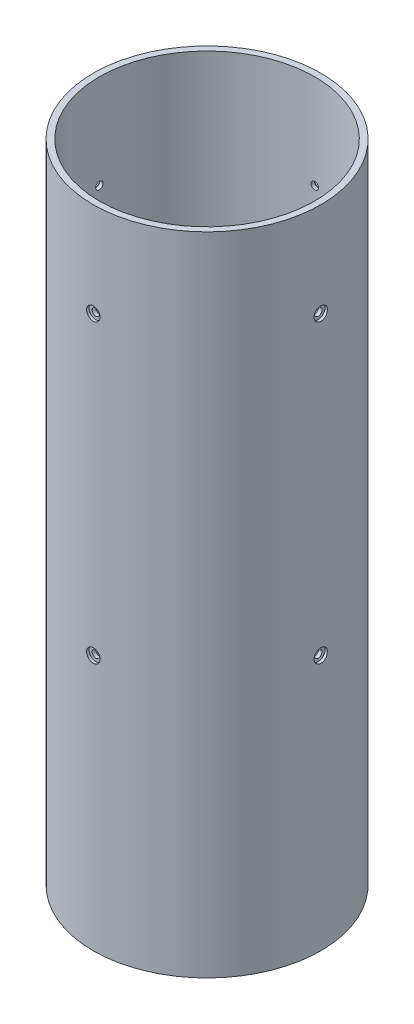
from build123d import *

# Parameters (mm, degrees)
SKETCH1_R             = 53.721
SKETCH1_R_2           = 50.8
BOSS_EXTRUDE1_DEPTH   = 304.8
SKETCH2_R             = 1.7526
BULKHEAD_HOLES_DEPTH  = 127
CIRPATTERN1_COUNT     = 4
CUT_EXTRUDE1_REACH    = 329.617
SKETCH3_R             = 1.7526
CIRPATTERN2_COUNT     = 4
SKETCH4_R             = 3.175
COUNTERSINK_CUT_DEPTH = 1.27
CIRPATTERN3_COUNT     = 4


with BuildPart() as part:
    # Sketch1 → Boss-Extrude1 (new body)
    with BuildSketch(Plane(origin=(0, 0, 0), x_dir=(1, 0, 0), z_dir=(0, 1, 0))):
        Circle(SKETCH1_R)
        Circle(SKETCH1_R_2, mode=Mode.SUBTRACT)
    extrude(amount=BOSS_EXTRUDE1_DEPTH)

    # Sketch2 → Bulkhead Holes (cut)
    with BuildSketch(Plane.XY):
        with Locations((0, 120.65)):
            Circle(SKETCH2_R)
    bulkhead_holes = extrude(amount=-BULKHEAD_HOLES_DEPTH, mode=Mode.SUBTRACT)

    # CirPattern1: Bulkhead Holes ×4 about axis
    cirpattern1_axis = Axis((0, 304.8, 0), (0, -1, 0))
    for i in range(1, CIRPATTERN1_COUNT):
        add(bulkhead_holes.rotate(cirpattern1_axis, i * 360 / CIRPATTERN1_COUNT), mode=Mode.SUBTRACT)

    # Sketch3 → Cut-Extrude1 (cut, up to next)
    with BuildSketch(Plane(origin=(53.721, 0, 0), x_dir=(0, 0, -1), z_dir=(1, 0, 0)), mode=Mode.PRIVATE) as cut_extrude1_sk1:
        with Locations((0, 260.35)):
            Circle(SKETCH3_R)
    cut_extrude1_tool1 = extrude(cut_extrude1_sk1.sketch, amount=-CUT_EXTRUDE1_REACH, mode=Mode.PRIVATE) & part.part
    cut_extrude1 = cut_extrude1_tool1.solids().sort_by_distance((53.721, 260.35, 0))[0]
    add(cut_extrude1, mode=Mode.SUBTRACT)

    # CirPattern2: Cut-Extrude1 ×4 about axis
    cirpattern2_axis = Axis((0, 304.8, 0), (0, -1, 0))
    for i in range(1, CIRPATTERN2_COUNT):
        add(cut_extrude1.rotate(cirpattern2_axis, i * 360 / CIRPATTERN2_COUNT), mode=Mode.SUBTRACT)

    # Sketch4 → Countersink Cut (cut)
    with BuildSketch(Plane(origin=(53.721, 0, 0), x_dir=(0, 0, -1), z_dir=(1, 0, 0))):
        with Locations((0, 260.35)):
            Circle(SKETCH4_R)
        with Locations((0, 120.65)):
            Circle(SKETCH4_R)
    countersink_cut = extrude(amount=-COUNTERSINK_CUT_DEPTH, mode=Mode.SUBTRACT)

    # CirPattern3: Countersink Cut ×4 about axis
    cirpattern3_axis = Axis((0, 304.8, 0), (0, -1, 0))
    for i in range(1, CIRPATTERN3_COUNT):
        add(countersink_cut.rotate(cirpattern3_axis, i * 360 / CIRPATTERN3_COUNT), mode=Mode.SUBTRACT)


solid = part.part
